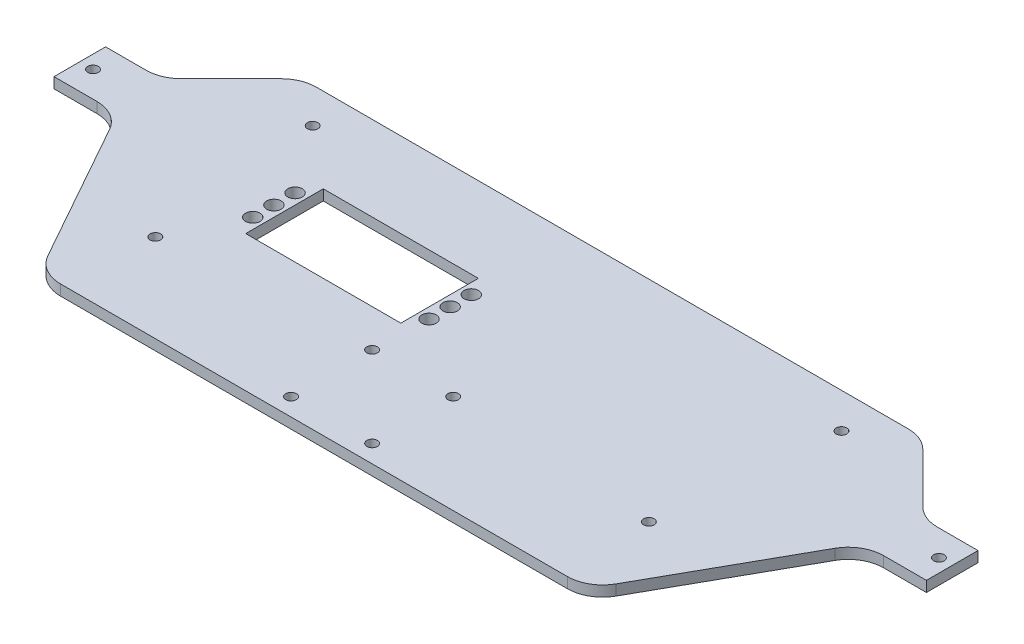
from build123d import *

# Parameters (mm, degrees)
SALIENTE_EXTRUIR1_DEPTH = 3
REDONDEO1_R             = 10
CROQUIS2_R              = 1.5
CROQUIS2_R_2            = 2.05
CROQUIS2_W              = 42
CROQUIS2_H              = 20
CORTAR_EXTRUIR1_DEPTH   = 135.610141171
CROQUIS3_W              = 4
CROQUIS3_H              = 14.636342218
CORTAR_EXTRUIR2_DEPTH   = 135.610141171
CROQUIS4_W              = 44
CROQUIS4_H              = 22
CORTAR_EXTRUIR3_DEPTH   = 131.820067673


with BuildPart() as part:
    # Croquis1 → Saliente-Extruir1 (new body)
    with BuildSketch(Plane(origin=(0, 0, 0), x_dir=(1, 0, 0), z_dir=(0, 1, 0))):
        Polygon((-88.1, 42.318171109), (88.1, 42.318171109), (108.1, 22.318171109), (127.75, 22.318171109), (127.75, 7.681828891), (105.75, 7.681828891), (77.75, -42.318171109), (-77.75, -42.318171109), (-105.75, 7.681828891), (-127.75, 7.681828891), (-127.75, 22.318171109), (-108.1, 22.318171109), align=None)
    extrude(amount=SALIENTE_EXTRUIR1_DEPTH)

    # Redondeo1
    redondeo1_edges = [part.edges().sort_by_distance(p)[0] for p in [
        (88.1, 1.5, -42.318171109),
        (-88.1, 1.5, -42.318171109),
        (-77.75, 1.5, 42.318171109),
        (77.75, 1.5, 42.318171109),
        (108.1, 1.5, -22.318171109),
        (105.75, 1.5, -7.681828891),
        (-105.75, 1.5, -7.681828891),
        (-108.1, 1.5, -22.318171109),
    ]]
    fillet(redondeo1_edges, radius=REDONDEO1_R)

    # Croquis2 → Cortar-Extruir1 (cut, through all)
    with BuildSketch(Plane(origin=(0, 3, 0), x_dir=(1, 0, 0), z_dir=(0, 1, 0))):
        with Locations((70, -17.318171109)):
            Circle(CROQUIS2_R)
        with Locations((-70, -17.318171109)):
            Circle(CROQUIS2_R)
        with Locations((-119.996067812, 15)):
            Circle(CROQUIS2_R)
        with Locations((119.996067812, 15)):
            Circle(CROQUIS2_R)
        with Locations((-75, 32.318171109)):
            Circle(CROQUIS2_R)
        with Locations((75, 32.318171109)):
            Circle(CROQUIS2_R)
        with Locations((-11.5, -14.318171109)):
            Circle(CROQUIS2_R)
        with Locations((11.5, -14.318171109)):
            Circle(CROQUIS2_R)
        with Locations((-11.5, -37.318171109)):
            Circle(CROQUIS2_R)
        with Locations((11.5, -37.318171109)):
            Circle(CROQUIS2_R)
        with Locations((-61, 7.318171109)):
            Circle(CROQUIS2_R_2)
        with Locations((-11, 7.318171109)):
            Circle(CROQUIS2_R_2)
        with Locations((-61, 13.318171109)):
            Circle(CROQUIS2_R_2)
        with Locations((-61, 1.318171109)):
            Circle(CROQUIS2_R_2)
        with Locations((-11, 13.318171109)):
            Circle(CROQUIS2_R_2)
        with Locations((-11, 1.318171109)):
            Circle(CROQUIS2_R_2)
        with Locations((-36, 7.318171109)):
            Rectangle(CROQUIS2_W, CROQUIS2_H)
    extrude(amount=-CORTAR_EXTRUIR1_DEPTH, mode=Mode.SUBTRACT)

    # Croquis3 → Cortar-Extruir2 (cut, through all)
    with BuildSketch(Plane(origin=(0, 3, 0), x_dir=(1, 0, 0), z_dir=(0, 1, 0))):
        with Locations((-125.75, 15)):
            Rectangle(CROQUIS3_W, CROQUIS3_H)
        with Locations((125.75, 15)):
            Rectangle(CROQUIS3_W, CROQUIS3_H)
    extrude(amount=-CORTAR_EXTRUIR2_DEPTH, mode=Mode.SUBTRACT)

    # Croquis4 → Cortar-Extruir3 (cut, through all)
    with BuildSketch(Plane(origin=(0, 3, 0), x_dir=(1, 0, 0), z_dir=(0, 1, 0))):
        with Locations((-36, 7.318171109)):
            Rectangle(CROQUIS4_W, CROQUIS4_H)
    extrude(amount=-CORTAR_EXTRUIR3_DEPTH, mode=Mode.SUBTRACT)


solid = part.part
